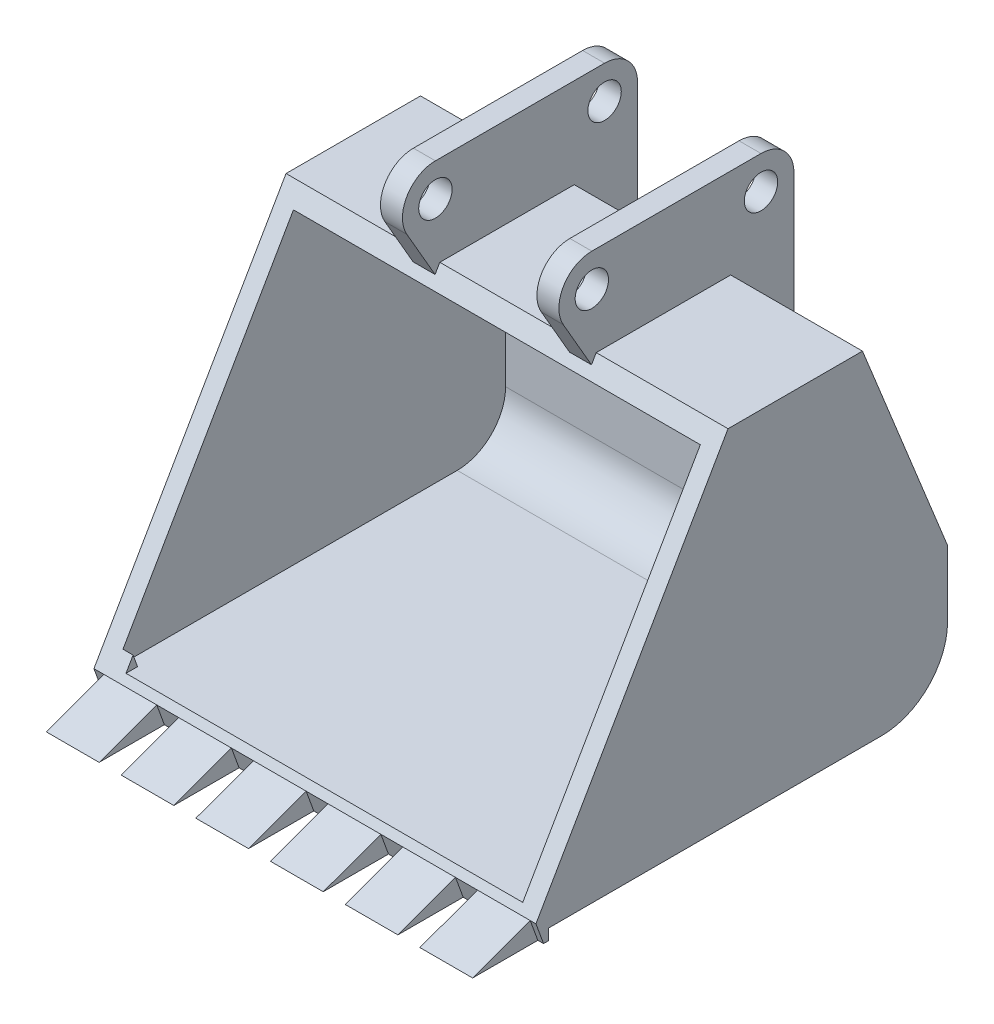
from build123d import *

# Parameters (mm, degrees)
BOSS_EXTRUDE1_DEPTH = 503
SKETCH2_W           = 23
SKETCH2_H           = 139.534422093
SKETCH2_W_2         = 50
SKETCH2_W_3         = 13
CUT_EXTRUDE1_DEPTH  = 1170.669741252
SHELL1_START        = -463
SHELL1_DEPTH        = 926
SHELL1_START_2      = -440
SHELL1_2_DEPTH      = 903
BOSS_EXTRUDE2_START = 153
SKETCH4_R           = 38
BOSS_EXTRUDE2_DEPTH = 50


# Read off the part's stored shape, not the designer's step: Shell1
with BuildPart() as part:
    # Sketch1 → Boss-Extrude1 (new, symmetric)
    with BuildSketch(Plane(origin=(0, 0, 0), x_dir=(0, 0, -1), z_dir=(1, 0, 0))):
        with BuildLine():
            Line((-150, 0), (-950, 0))
            Line((-950, 0), (-499.666790032, 780))
            Line((-499.666790032, 780), (-193.666790032, 780))
            Line((-193.666790032, 780), (0, 300))
            Line((0, 300), (0, 150))
            ThreePointArc((0, 150), (-43.933982822, 43.933982822), (-150, 0))
        make_face()
        Polygon((-908, -25), (-908, 0), (-950, 0), (-936.880533213, 22.723583043), (-1068, -25), align=None)
    extrude(amount=BOSS_EXTRUDE1_DEPTH, both=True)

    # Sketch2 → Cut-Extrude1 (cut, through all)
    with BuildSketch(Plane(origin=(0, 321.173028034, 116.897422253), x_dir=(1, 0, 0), z_dir=(0, 0.9396926207859103, 0.34202014332566333))):
        with Locations((-491.5, -942.375011536)):
            Rectangle(SKETCH2_W, SKETCH2_H)
        with Locations((-335, -942.375011536)):
            Rectangle(SKETCH2_W_2, SKETCH2_H)
        with Locations((-165, -942.375011536)):
            Rectangle(SKETCH2_W_2, SKETCH2_H)
        with Locations((5, -942.375011536)):
            Rectangle(SKETCH2_W_2, SKETCH2_H)
        with Locations((175, -942.375011536)):
            Rectangle(SKETCH2_W_2, SKETCH2_H)
        with Locations((345, -942.375011536)):
            Rectangle(SKETCH2_W_2, SKETCH2_H)
        with Locations((496.5, -942.375011536)):
            Rectangle(SKETCH2_W_3, SKETCH2_H)
    extrude(amount=-CUT_EXTRUDE1_DEPTH, mode=Mode.SUBTRACT)

    # Shell1 outline → Shell1 (cut)
    with BuildSketch(Plane.YZ.offset(SHELL1_START)):
        with BuildLine():
            Line((67.944218037, 910.772387426), (40, 900.601523841))
            Line((40, 900.601523841), (40, 150))
            ThreePointArc((40, 150), (72.218254069, 72.218254069), (150, 40))
            Line((150, 40), (292.234669594, 40))
            Line((292.234669594, 40), (740, 220.660987974))
            Line((740, 220.660987974), (740, 522.7608008))
            Line((740, 522.7608008), (67.944218037, 910.772387426))
        make_face()
    extrude(amount=SHELL1_DEPTH, mode=Mode.SUBTRACT)

    # Shell1 2 outline → Shell1 2 (cut)
    with BuildSketch(Plane.YZ.offset(SHELL1_START_2)):
        Polygon((67.944218037, 910.772387426), (40, 926.905989232), (40, 900.601523841), align=None)
    extrude(amount=SHELL1_2_DEPTH, mode=Mode.SUBTRACT)

    # Sketch4 → Boss-Extrude2 (add)
    with BuildSketch(Plane(origin=(0, 0, 0), x_dir=(0, 0, -1), z_dir=(1, 0, 0)).offset(BOSS_EXTRUDE2_START)):
        with BuildLine():
            Line((-49.666790032, 423.098334058), (-49.666790032, 910))
            ThreePointArc((-49.666790032, 910), (-71.633781443, 963.033008589), (-124.666790032, 985))
            Line((-124.666790032, 985), (-509.666790032, 985))
            ThreePointArc((-509.666790032, 985), (-574.618695316, 947.5), (-574.618695316, 872.5))
            Line((-574.618695316, 872.5), (-510.440292724, 761.339745962))
            Line((-510.440292724, 761.339745962), (-499.666790032, 780))
            Line((-499.666790032, 780), (-193.666790032, 780))
            Line((-193.666790032, 780), (-49.666790032, 423.098334058))
        make_face()
        with Locations((-509.666790032, 910)):
            Circle(SKETCH4_R, mode=Mode.SUBTRACT)
        with Locations((-124.666790032, 910)):
            Circle(SKETCH4_R, mode=Mode.SUBTRACT)
    boss_extrude2 = extrude(amount=BOSS_EXTRUDE2_DEPTH)

    # Mirror1: Boss-Extrude2 across plane
    add(boss_extrude2.mirror(Plane(origin=(0, 0, 0), x_dir=(0, 0, 1), z_dir=(1, 0, 0))))


solid = part.part
